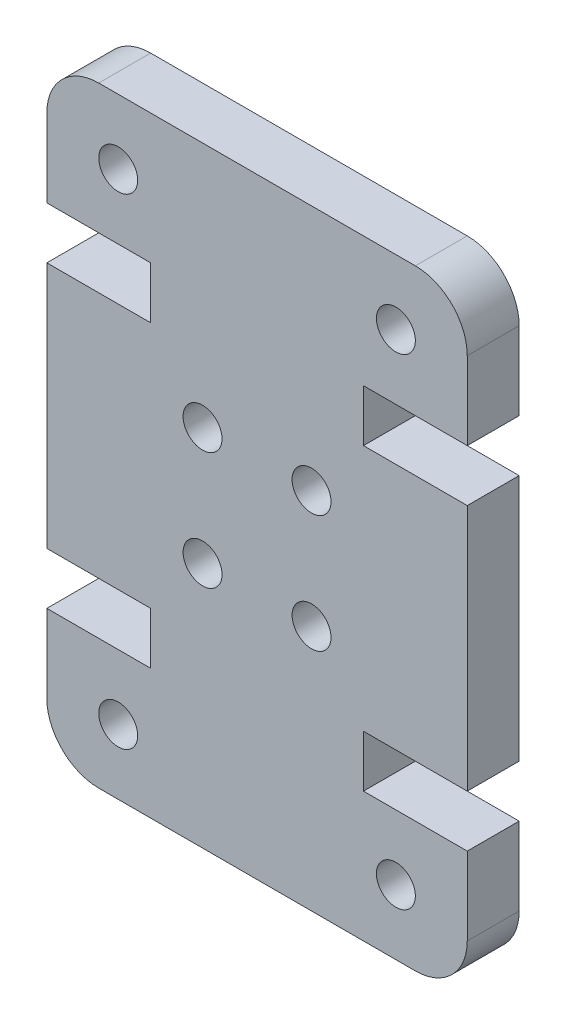
from build123d import *

# Parameters (mm, degrees)
SKETCH1_R           = 0.75
BOSS_EXTRUDE1_DEPTH = 2


with BuildPart() as part:
    # Sketch1 → Boss-Extrude1 (new body)
    with BuildSketch(Plane.XY):
        with BuildLine():
            Line((0, 7), (0, 16.53))
            Line((0, 16.53), (4, 16.53))
            Line((4, 16.53), (4, 18.53))
            Line((4, 18.53), (0, 18.53))
            Line((0, 18.53), (0, 21.53))
            ThreePointArc((0, 21.53), (0.585786438, 22.944213562), (2, 23.53))
            Line((2, 23.53), (14.2, 23.53))
            ThreePointArc((14.2, 23.53), (15.614213562, 22.944213562), (16.2, 21.53))
            Line((16.2, 21.53), (16.2, 18.53))
            Line((16.2, 18.53), (12.2, 18.53))
            Line((12.2, 18.53), (12.2, 16.53))
            Line((12.2, 16.53), (16.2, 16.53))
            Line((16.2, 16.53), (16.2, 7))
            Line((16.2, 7), (12.2, 7))
            Line((12.2, 7), (12.2, 5))
            Line((12.2, 5), (16.2, 5))
            Line((16.2, 5), (16.2, 2))
            ThreePointArc((16.2, 2), (15.614213562, 0.585786438), (14.2, 0))
            Line((14.2, 0), (2, 0))
            ThreePointArc((2, 0), (0.585786438, 0.585786438), (0, 2))
            Line((0, 2), (0, 5))
            Line((0, 5), (4, 5))
            Line((4, 5), (4, 7))
            Line((4, 7), (0, 7))
        make_face()
        with Locations((10.2, 9.5)):
            Circle(SKETCH1_R, mode=Mode.SUBTRACT)
        with Locations((6, 9.5)):
            Circle(SKETCH1_R, mode=Mode.SUBTRACT)
        with Locations((6, 14.03)):
            Circle(SKETCH1_R, mode=Mode.SUBTRACT)
        with Locations((10.2, 14.03)):
            Circle(SKETCH1_R, mode=Mode.SUBTRACT)
        with Locations((13.45, 2.5)):
            Circle(SKETCH1_R, mode=Mode.SUBTRACT)
        with Locations((2.75, 2.5)):
            Circle(SKETCH1_R, mode=Mode.SUBTRACT)
        with Locations((13.45, 21.03)):
            Circle(SKETCH1_R, mode=Mode.SUBTRACT)
        with Locations((2.75, 21.03)):
            Circle(SKETCH1_R, mode=Mode.SUBTRACT)
    extrude(amount=BOSS_EXTRUDE1_DEPTH)


solid = part.part
